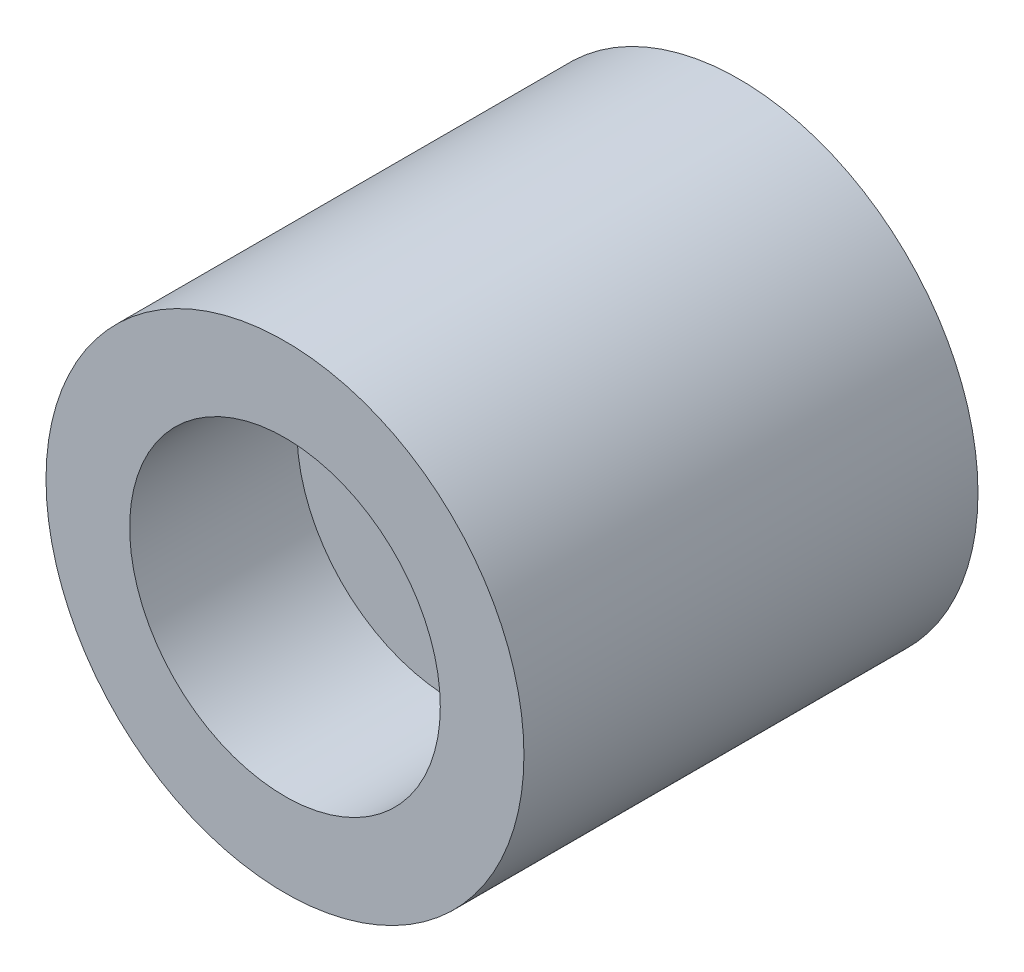
from build123d import *

# Parameters (mm, degrees)
SKETCH_1_R          = 10
EXTRUDE_1_DEPTH     = 19
SKETCH_2_R          = 6.5
CUT_EXTRUDE_1_DEPTH = 7


with BuildPart() as part:
    # Эскиз1 → Бобышка-Вытянуть1 (new body)
    with BuildSketch(Plane.XY):
        Circle(SKETCH_1_R)
    extrude(amount=EXTRUDE_1_DEPTH)

    # Эскиз2 → Вырез-Вытянуть1 (cut)
    with BuildSketch(Plane.XY.offset(19)):
        Circle(SKETCH_2_R)
    extrude(amount=-CUT_EXTRUDE_1_DEPTH, mode=Mode.SUBTRACT)


solid = part.part
